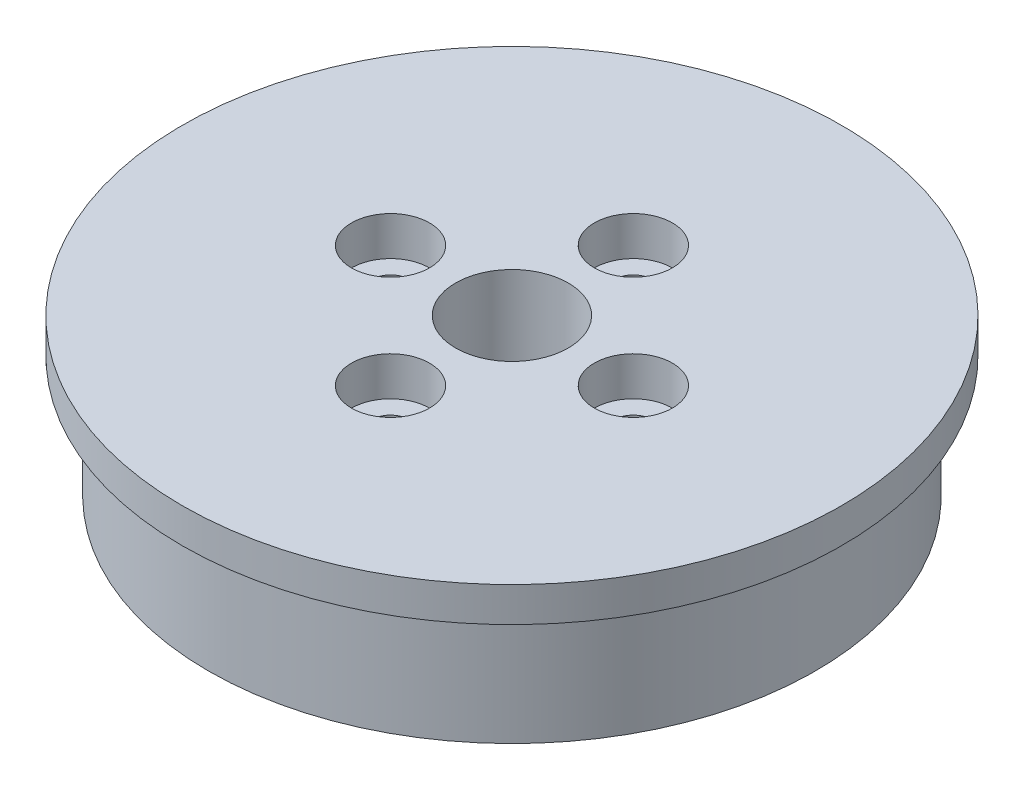
from build123d import *

# Parameters (mm, degrees)
SKETCH_1_R          = 19
EXTRUDE_1_DEPTH     = 10.45
SKETCH_2_R          = 35.878367213
SKETCH_2_R_2        = 10
CUT_EXTRUDE_1_DEPTH = 1.45
SKETCH_2_3_R        = 35.878367213
SKETCH_2_3_R_2      = 17.5
CUT_EXTRUDE_2_DEPTH = 8.45
SKETCH_3_R          = 3.25
SKETCH_3_R_2        = 1.1
CUT_EXTRUDE_3_DEPTH = 29.83058272
CUT_EXTRUDE_START   = 8.2
SKETCH_3_3_R        = 2.25
CUT_EXTRUDE_4_DEPTH = 21.63058272
SKETCH_4_R          = 16
SKETCH_4_R_2        = 10
CUT_EXTRUDE_5_DEPTH = 2.2
SKETCH_5_R          = 4.5
CUT_EXTRUDE_6_DEPTH = 2


with BuildPart() as part:
    # Эскиз1 → Бобышка-Вытянуть1 (new body)
    with BuildSketch(Plane(origin=(0, 0, 0), x_dir=(1, 0, 0), z_dir=(0, 1, 0))):
        Circle(SKETCH_1_R)
    extrude(amount=EXTRUDE_1_DEPTH)

    # Эскиз2 → Вырез-Вытянуть1 (cut)
    with BuildSketch(Plane(origin=(0, 0, 0), x_dir=(1, 0, 0), z_dir=(0, 1, 0))):
        Circle(SKETCH_2_R)
        Circle(SKETCH_2_R_2, mode=Mode.SUBTRACT)
    extrude(amount=CUT_EXTRUDE_1_DEPTH, mode=Mode.SUBTRACT)

    # Эскиз2<3> → Вырез-Вытянуть2 (cut)
    with BuildSketch(Plane(origin=(0, 0, 0), x_dir=(1, 0, 0), z_dir=(0, 1, 0))):
        Circle(SKETCH_2_3_R)
        Circle(SKETCH_2_3_R_2, mode=Mode.SUBTRACT)
    extrude(amount=CUT_EXTRUDE_2_DEPTH, mode=Mode.SUBTRACT)

    # Эскиз3 → Вырез-Вытянуть3 (cut, through all)
    with BuildSketch(Plane(origin=(0, 0, 0), x_dir=(1, 0, 0), z_dir=(0, 1, 0))):
        Circle(SKETCH_3_R)
        with Locations((0, 7)):
            Circle(SKETCH_3_R_2)
        with Locations((-7, 0)):
            Circle(SKETCH_3_R_2)
        with Locations((0, -7)):
            Circle(SKETCH_3_R_2)
        with Locations((7, 0)):
            Circle(SKETCH_3_R_2)
    extrude(amount=CUT_EXTRUDE_3_DEPTH, mode=Mode.SUBTRACT)

    # Эскиз3<3> → Вырез-Вытянуть4 (cut, through all)
    with BuildSketch(Plane(origin=(0, 0, 0), x_dir=(1, 0, 0), z_dir=(0, 1, 0)).offset(CUT_EXTRUDE_START)):
        with Locations((0, 7)):
            Circle(SKETCH_3_3_R)
        with Locations((7, 0)):
            Circle(SKETCH_3_3_R)
        with Locations((0, -7)):
            Circle(SKETCH_3_3_R)
        with Locations((-7, 0)):
            Circle(SKETCH_3_3_R)
    extrude(amount=CUT_EXTRUDE_4_DEPTH, mode=Mode.SUBTRACT)

    # Эскиз4 → Вырез-Вытянуть5 (cut)
    with BuildSketch(Plane(origin=(0, 0, 0), x_dir=(1, 0, 0), z_dir=(0, 1, 0))):
        Circle(SKETCH_4_R)
        Circle(SKETCH_4_R_2, mode=Mode.SUBTRACT)
    extrude(amount=CUT_EXTRUDE_5_DEPTH, mode=Mode.SUBTRACT)

    # Эскиз5 → Вырез-Вытянуть6 (cut)
    with BuildSketch(Plane(origin=(0, 0, 0), x_dir=(1, 0, 0), z_dir=(0, 1, 0))):
        Circle(SKETCH_5_R)
    extrude(amount=CUT_EXTRUDE_6_DEPTH, mode=Mode.SUBTRACT)


solid = part.part
